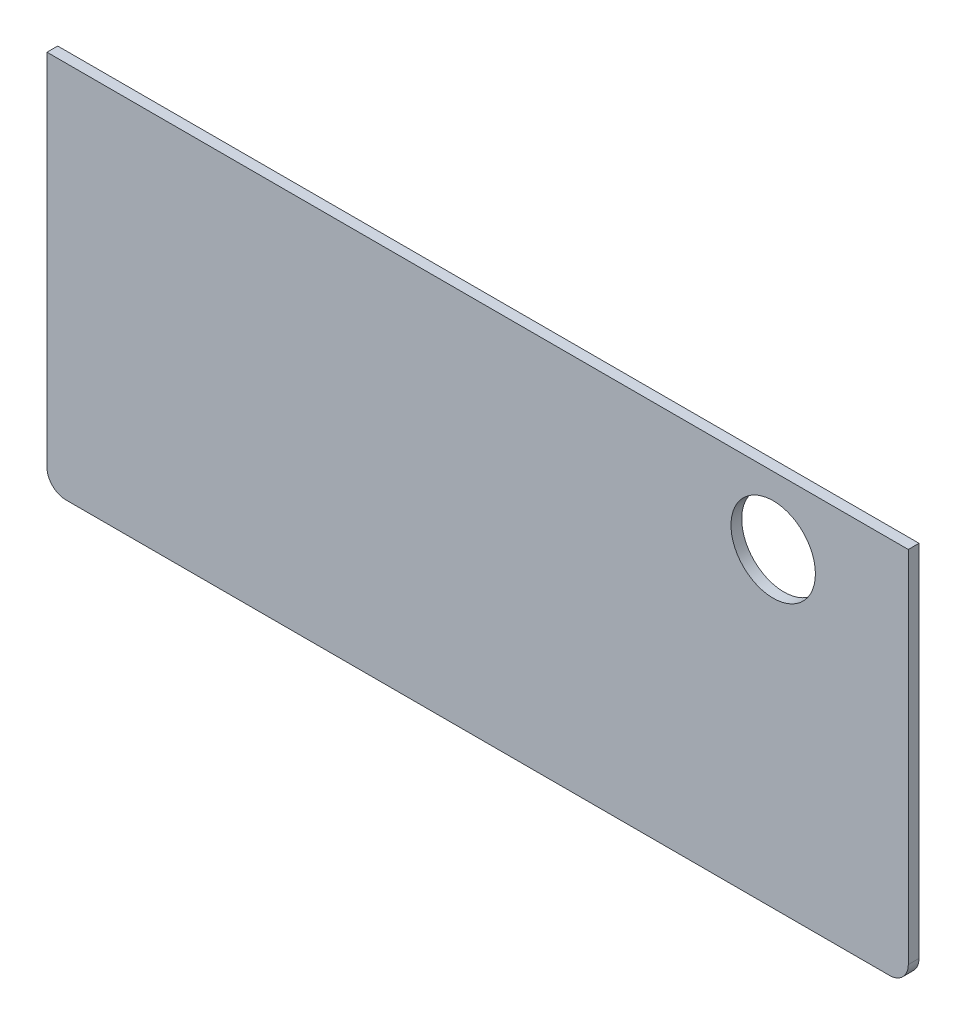
from build123d import *

# Parameters (mm, degrees)
SKETCH1_W           = 255
SKETCH1_H           = 112
SKETCH1_R           = 12.5
BOSS_EXTRUDE1_DEPTH = 3.175
FILLET1_R           = 5.55625


with BuildPart() as part:
    # Sketch1 → Boss-Extrude1 (new body)
    with BuildSketch(Plane.XY):
        with Locations((-24.265375854, -28.813211845)):
            Rectangle(SKETCH1_W, SKETCH1_H)
        with Locations((63.234624146, 7.186788155)):
            Circle(SKETCH1_R, mode=Mode.SUBTRACT)
    extrude(amount=BOSS_EXTRUDE1_DEPTH)

    # Fillet1
    fillet1_edges = [part.edges().sort_by_distance(p)[0] for p in [
        (-151.765375854, -84.813211845, 1.5875),
        (103.234624146, -84.813211845, 1.5875),
    ]]
    fillet(fillet1_edges, radius=FILLET1_R)


solid = part.part
